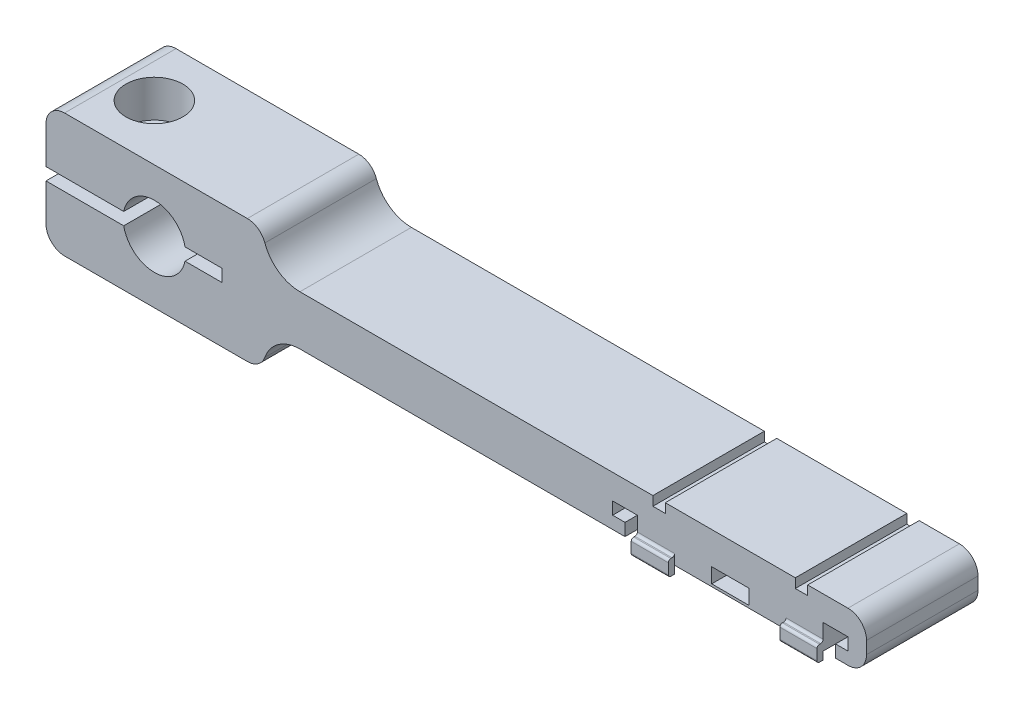
from build123d import *

# Parameters (mm, degrees)
BEAM_FOOTPRINT_DEPTH          = 18
FILLET1_R                     = 6
FILLET2_R                     = 3
FILLET3_R                     = 3
SKETCH7_R                     = 2.7
M5_BOLT_DEPTH                 = 119.105884826
SKETCH9_W                     = 6
SKETCH9_H                     = 2.8
FS_CUTOUT_DEPTH               = 6
M5_NUT_CUTOUT_DEPTH           = 5
RUBBER_BAND_NOTCH_DEPTH       = 116.784282296
RUBBER_BAND_NOTCH_DEPTH_BACK  = 116.784282296
SKETCH10_W                    = 2
SKETCH10_H                    = 1.5
WIRE_CUTOUT_DEPTH             = 117.404467388
WIRE_CUTOUT_DEPTH_BACK        = 117.404467388
SKETCH13_W                    = 6
SKETCH13_H                    = 2.4
SKETCH15_R                    = 4.6
M5_BOLT_HEAD_DEPTH            = 6
SLIDE_PLATE_CUTOUT_DEPTH      = 117.828934895
SLIDE_PLATE_CUTOUT_DEPTH_BACK = 117.828934895
SKETCH17_W                    = 6
SKETCH17_H                    = 2.5
FS_COVER_STOP_DEPTH           = 1
FILLET4_R                     = 0.4


with BuildPart() as part:
    # Sketch1 → beam footprint (new body)
    with BuildSketch(Plane.XY):
        with BuildLine():
            Line((17.5, -4), (17.5, -10))
            Line((17.5, -10), (-17.5, -10))
            Line((-17.5, -10), (-17.5, -1))
            Line((-17.5, -1), (-4.95, -1))
            ThreePointArc((-4.95, -1), (0, -5.05), (4.95, -1))
            Line((4.95, -1), (10.95, -1))
            Line((10.95, -1), (10.95, 1))
            Line((10.95, 1), (4.95, 1))
            ThreePointArc((4.95, 1), (0, 5.05), (-4.95, 1))
            Line((-4.95, 1), (-17.5, 1))
            Line((-17.5, 1), (-17.5, 10))
            Line((-17.5, 10), (17.5, 10))
            Line((17.5, 10), (17.5, 4))
            Line((17.5, 4), (115, 4))
            Line((115, 4), (115, -4))
            Line((115, -4), (17.5, -4))
        make_face()
    extrude(amount=BEAM_FOOTPRINT_DEPTH)

    # Fillet1
    fillet1_edges = [part.edges().sort_by_distance(p)[0] for p in [
        (17.5, -4, 9),
        (17.5, 4, 9),
    ]]
    fillet(fillet1_edges, radius=FILLET1_R - 0.0001)  # a hair under: the kernel refuses the full size

    # Fillet2
    fillet2_edges = [part.edges().sort_by_distance(p)[0] for p in [
        (17.5, -10, 9),
        (-17.5, -10, 9),
        (-17.5, 10, 9),
        (17.5, 10, 9),
    ]]
    fillet(fillet2_edges, radius=FILLET2_R)

    # Fillet3
    fillet3_edges = [part.edges().sort_by_distance(p)[0] for p in [
        (115, 4, 9),
        (115, -4, 9),
    ]]
    fillet(fillet3_edges, radius=FILLET3_R)

    # Sketch7 → M5 Bolt (cut, through all)
    with BuildSketch(Plane(origin=(0, 10, 0), x_dir=(1, 0, 0), z_dir=(0, 1, 0))):
        with Locations(Location((-9, -9, 0), (0, 0, 270))):
            Circle(SKETCH7_R)
    extrude(amount=-M5_BOLT_DEPTH, mode=Mode.SUBTRACT)

    # Sketch9 → FS Cutout (cut, symmetric)
    with BuildSketch(Plane.XY.offset(9)):
        with Locations((93, -2.6)):
            Rectangle(SKETCH9_W, SKETCH9_H)
    extrude(amount=FS_CUTOUT_DEPTH, both=True, mode=Mode.SUBTRACT)

    # Sketch16 → M5 Nut cutout (cut)
    with BuildSketch(Plane.XZ.offset(10)):
        Polygon((-4.9, 9), (-6.95, 12.550704156), (-11.05, 12.550704156), (-13.1, 9), (-11.05, 5.449295844), (-6.95, 5.449295844), align=None)
    extrude(amount=-M5_NUT_CUTOUT_DEPTH, mode=Mode.SUBTRACT)

    # Sketch10 → Rubber Band Notch (cut, two sides: drawn at the far end of the back side and taken through both)
    with BuildSketch(Plane.XY.offset(9).offset(-RUBBER_BAND_NOTCH_DEPTH_BACK)):
        with Locations((81.5, 3.25)):
            Rectangle(SKETCH10_W, SKETCH10_H)
        with Locations((104.5, 3.25)):
            Rectangle(SKETCH10_W, SKETCH10_H)
    extrude(amount=RUBBER_BAND_NOTCH_DEPTH + RUBBER_BAND_NOTCH_DEPTH_BACK, mode=Mode.SUBTRACT)

    # Sketch13 → Wire Cutout (cut, two sides: drawn at the far end of the back side and taken through both)
    with BuildSketch(Plane.XY.offset(3).offset(-WIRE_CUTOUT_DEPTH_BACK)):
        with Locations((93, -2.4)):
            Rectangle(SKETCH13_W, SKETCH13_H)
    extrude(amount=WIRE_CUTOUT_DEPTH + WIRE_CUTOUT_DEPTH_BACK, mode=Mode.SUBTRACT)

    # Sketch15 → M5 Bolt Head (cut)
    with BuildSketch(Plane(origin=(0, 10, 0), x_dir=(1, 0, 0), z_dir=(0, 1, 0))):
        with Locations(Location((-9, -9, 0), (0, 0, 270))):
            Circle(SKETCH15_R)
    extrude(amount=-M5_BOLT_HEAD_DEPTH, mode=Mode.SUBTRACT)

    # Sketch14 → Slide Plate Cutout (cut, two sides: drawn at the far end of the back side and taken through both)
    with BuildSketch(Plane.XY.offset(18).offset(-SLIDE_PLATE_CUTOUT_DEPTH_BACK)):
        Polygon((108, -4), (108, 0), (112, 0), (112, -2), (110, -2), (110, -4), align=None)
        Polygon((78, -4), (76, -4), (76, -2), (74, -2), (74, 0), (78, 0), align=None)
    extrude(amount=SLIDE_PLATE_CUTOUT_DEPTH + SLIDE_PLATE_CUTOUT_DEPTH_BACK, mode=Mode.SUBTRACT)

    # Sketch17 → FS cover stop (add)
    with BuildSketch(Plane.XY.offset(18)):
        with Locations((81, -4)):
            Rectangle(SKETCH17_W, SKETCH17_H)
        with Locations((105, -4)):
            Rectangle(SKETCH17_W, SKETCH17_H)
    extrude(amount=FS_COVER_STOP_DEPTH)

    # Fillet4
    fillet4_edges = [part.edges().sort_by_distance(p)[0] for p in [
        (81, -2.75, 18),
        (81, -5.25, 19),
        (81, -2.75, 19),
        (105, -2.75, 18),
        (105, -5.25, 19),
        (105, -2.75, 19),
    ]]
    fillet(fillet4_edges, radius=FILLET4_R)


solid = part.part
